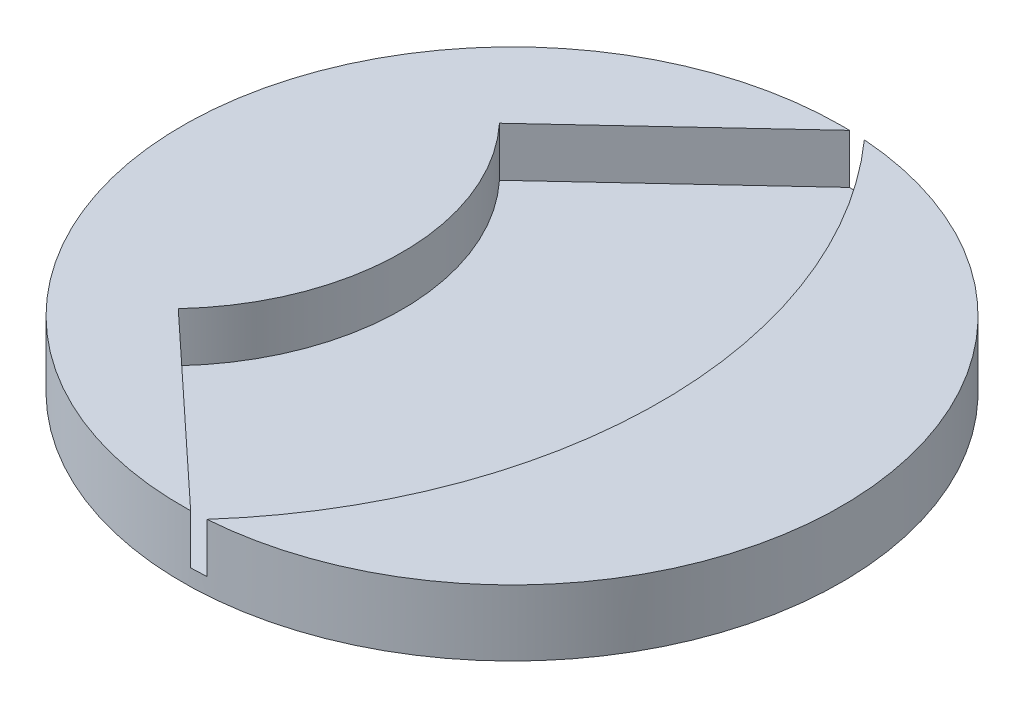
from build123d import *

# Parameters (mm, degrees)
CUT_EXTRUDE1_DEPTH = 3


with BuildPart() as part:
    # Sketch1 → Revolve1 (revolve)
    with BuildSketch(Plane.XY):
        Polygon((1.15, -2), (1.15, 2), (0, 2), (0, 6), (20, 6), (20, 2), (3.15, 2), (3.15, -2), align=None)
    revolve(axis=Axis((0, -3.539189189, 0), (0, 1, 0)))

    # Sketch2 → Cut-Extrude1 (cut)
    with BuildSketch(Plane(origin=(0, 6, 0), x_dir=(1, 0, 0), z_dir=(0, 1, 0))):
        with BuildLine():
            Line((0.976776483, 20.449162801), (-10.510738758, 9.747434268))
            ThreePointArc((-10.510738758, 9.747434268), (-6.673889583, 0), (-10.510738758, -9.747434268))
            Line((-10.510738758, -9.747434268), (0.976776483, -20.449162801))
            ThreePointArc((0.976776483, -20.449162801), (9.026110417, 0), (0.976776483, 20.449162801))
        make_face()
    extrude(amount=-CUT_EXTRUDE1_DEPTH, mode=Mode.SUBTRACT)


solid = part.part
